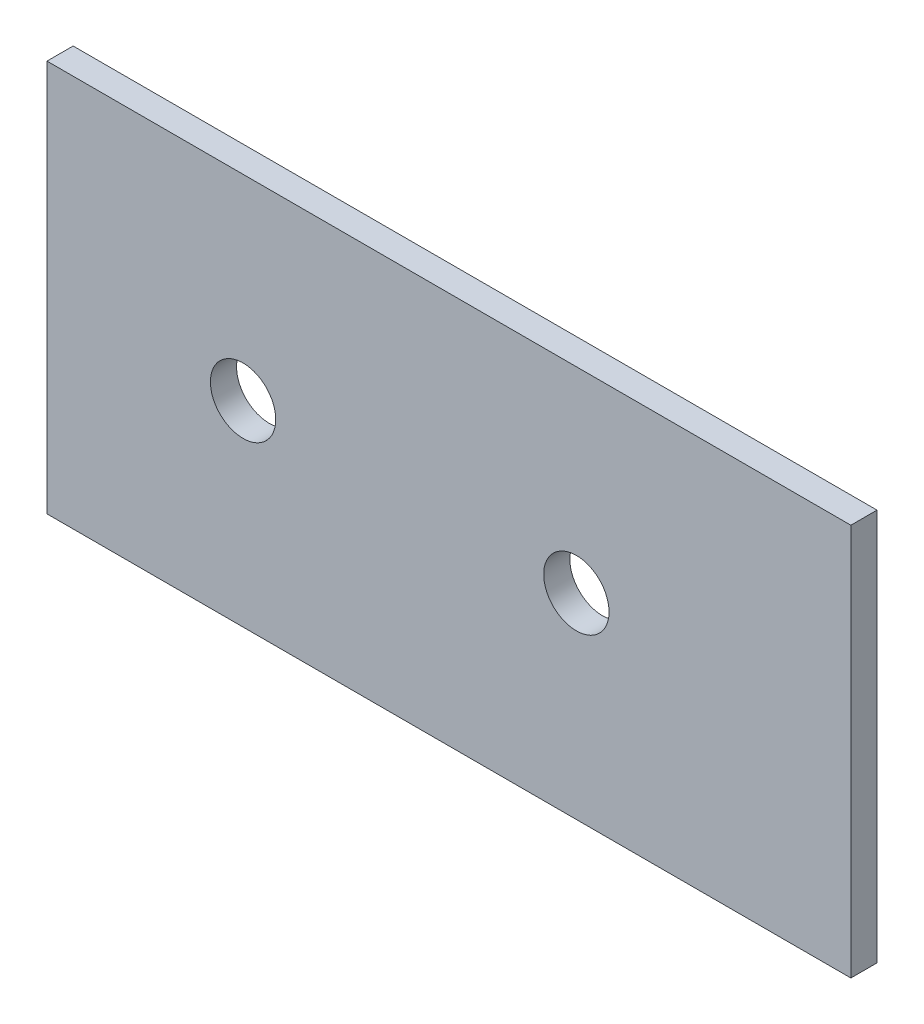
from build123d import *

# Parameters (mm, degrees)
SKETCH1_W           = 123
SKETCH1_H           = 60
SKETCH1_R           = 5
BOSS_EXTRUDE1_DEPTH = 4


with BuildPart() as part:
    # Sketch1 → Boss-Extrude1 (new body)
    with BuildSketch(Plane.XY):
        with Locations((-19.5, 0)):
            Rectangle(SKETCH1_W, SKETCH1_H)
        Circle(SKETCH1_R, mode=Mode.SUBTRACT)
        with Locations((-51, 0)):
            Circle(SKETCH1_R, mode=Mode.SUBTRACT)
    extrude(amount=BOSS_EXTRUDE1_DEPTH)


solid = part.part
